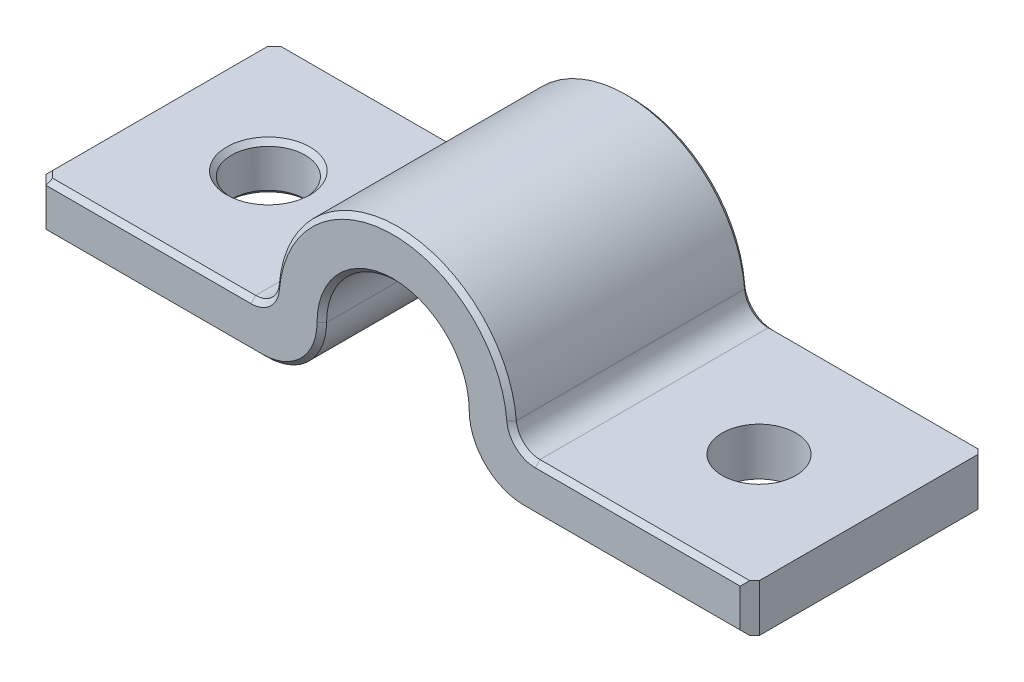
from build123d import *

# Parameters (mm, degrees)
EXTRUDE_3_DEPTH     = 10
FILLET_2_R          = 1
FILLET_3_R          = 2.5
CHAMFER_1_SIZE      = 0.4
SKETCH_5_R          = 1.55
CUT_EXTRUDE_2_DEPTH = 12
CHAMFER_2_SIZE      = 0.2


with BuildPart() as part:
    # 草图4 → 凸台-拉伸3 (new body)
    with BuildSketch(Plane.XY):
        with BuildLine():
            Line((-5, 0), (-5, -0.5))
            Line((-5, -0.5), (-15, -0.5))
            Line((-15, -0.5), (-15, -2.5))
            Line((-15, -2.5), (-5, -2.5))
            Line((-5, -2.5), (-3, -2.5))
            Line((-3, -2.5), (-3, 0))
            ThreePointArc((-3, 0), (0, 3), (3, 0))
            Line((3, 0), (3, -2.5))
            Line((3, -2.5), (5, -2.5))
            Line((5, -2.5), (15, -2.5))
            Line((15, -2.5), (15, -0.5))
            Line((15, -0.5), (5, -0.5))
            Line((5, -0.5), (5, 0))
            ThreePointArc((5, 0), (0, 5), (-5, 0))
        make_face()
    extrude(amount=EXTRUDE_3_DEPTH)

    # 圆角2
    fillet_2_edges = [part.edges().sort_by_distance(p)[0] for p in [
        (5, -0.5, 5),
        (-5, -0.5, 5),
    ]]
    fillet(fillet_2_edges, radius=FILLET_2_R)

    # 圆角3
    fillet_3_edges = [part.edges().sort_by_distance(p)[0] for p in [
        (-3, -2.5, 5),
        (3, -2.5, 5),
    ]]
    fillet(fillet_3_edges, radius=FILLET_3_R - 0.0001)  # a hair under: the kernel refuses the full size

    # 倒角1
    chamfer_1_edges = [part.edges().sort_by_distance(p)[0] for p in [
        (-15, -1.5, 0),
        (15, -1.5, 0),
        (15, -1.5, 10),
        (-15, -1.5, 10),
    ]]
    chamfer(chamfer_1_edges, length=CHAMFER_1_SIZE)

    # 草图5 → 切除-拉伸2 (cut)
    with BuildSketch(Plane(origin=(0, -0.5, 0), x_dir=(1, 0, 0), z_dir=(0, 1, 0))):
        with Locations(Location((-10.24814383, -5, 0), (0, 0, 180))):
            Circle(SKETCH_5_R)
        with Locations(Location((10.389565186, -5, 0), (0, 0, 180))):
            Circle(SKETCH_5_R)
    extrude(amount=-CUT_EXTRUDE_2_DEPTH, mode=Mode.SUBTRACT)

    # 倒角2
    chamfer_2_edges = [part.edges().sort_by_distance(p)[0] for p in [
        (0, 3, 0),
        (0, 5, 0),
        (0, 5, 10),
        (-10.289565186, -0.5, 0),
        (-10.289565186, -0.5, 10),
        (5.302127171, -0.235980072, 0),
        (5.302127171, -0.235980072, 10),
        (-5.302127171, -0.235980072, 0),
        (-5.302127171, -0.235980072, 10),
        (10.04995, -2.5, 0),
        (3.732203758, -1.767796242, 0),
        (-3.732203758, -1.767796242, 0),
        (10.04995, -2.5, 10),
        (3.732203758, -1.767796242, 10),
        (-3.732203758, -1.767796242, 10),
        (-10.04995, -2.5, 10),
        (10.289565186, -0.5, 10),
        (10.289565186, -0.5, 0),
        (-10.04995, -2.5, 0),
        (-15, -2.5, 5),
        (-14.8, -2.5, 0.2),
        (-14.8, -2.5, 9.8),
        (-15, -0.5, 5),
        (-14.8, -0.5, 0.2),
        (-14.8, -0.5, 9.8),
        (0, 3, 10),
        (-8.69814383, -2.5, 5),
        (-8.69814383, -0.5, 5),
    ]]
    chamfer(chamfer_2_edges, length=CHAMFER_2_SIZE)


solid = part.part
